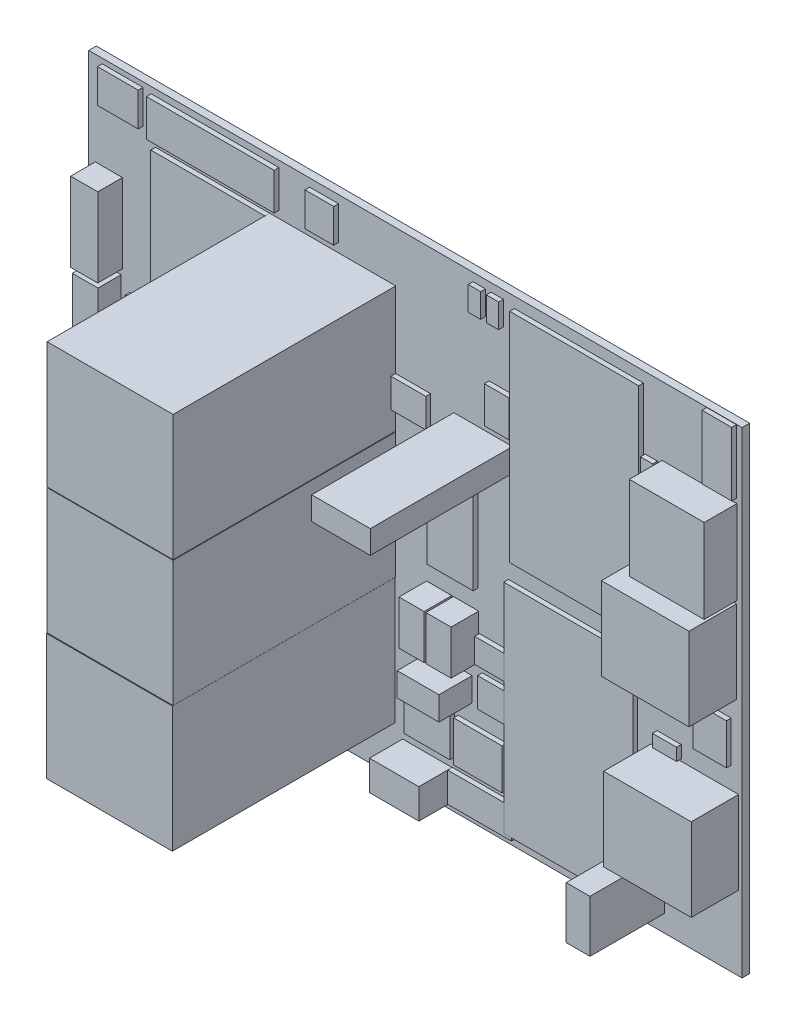
from build123d import *

# Parameters (mm, degrees)
ESQUISSE1_W                                    = 137.93375
ESQUISSE1_H                                    = 100.635
BOARD_DEPTH                                    = 1.6
ESQUISSE2_W                                    = 1.78
ESQUISSE2_H                                    = 3.14
CAP_0805_1_DEPTH                               = 1
ESQUISSE3_W                                    = 1.78
ESQUISSE3_H                                    = 3.14
CAP_0805_2_DEPTH                               = 1
ESQUISSE4_W                                    = 3.14
ESQUISSE4_H                                    = 1.78
CAP_0805_3_DEPTH                               = 1
ESQUISSE5_W                                    = 3.14
ESQUISSE5_H                                    = 1.78
CAP_0805_4_DEPTH                               = 1
ESQUISSE6_W                                    = 1.9914
ESQUISSE6_H                                    = 3.9968
EXTRUDE_C0805_1_DEPTH                          = 1
ESQUISSE7_W                                    = 1.9914
ESQUISSE7_H                                    = 3.9968
EXTRUDE_C0805_2_DEPTH                          = 1
ESQUISSE8_W                                    = 26.6
ESQUISSE8_H                                    = 26.55
SLPX102M200C4P3_47_000000_1_DEPTH              = 47
ESQUISSE9_W                                    = 26.6
ESQUISSE9_H                                    = 26.55
BOARD_OUTLINE2_DEPTH                           = 47
ESQUISSE10_W                                   = 26.6
ESQUISSE10_H                                   = 26.55
SLPX102M200C4P3_47_000000_3_DEPTH              = 47
ESQUISSE11_W                                   = 5.425
ESQUISSE11_H                                   = 10.85
TO254P490X1000X2143_3P_4_900000_1_DEPTH        = 4.9
ESQUISSE12_W                                   = 5.425
ESQUISSE12_H                                   = 10.85
TO254P490X1000X2143_3P_4_900000_2_DEPTH        = 4.9
ESQUISSE13_W                                   = 6.35
ESQUISSE13_H                                   = 3.625
SOP50P490X110_10N_1_100000_1_DEPTH             = 1.1
ESQUISSE14_W                                   = 7.6835
ESQUISSE14_H                                   = 5.1435
AVRISP_1_DEPTH                                 = 1
ESQUISSE15_W                                   = 18.5
ESQUISSE15_H                                   = 17.49
UJ2BH1TH_10_000000_1_DEPTH                     = 10
ESQUISSE16_W                                   = 18.5
ESQUISSE16_H                                   = 17.49
UJ2BH1TH_10_000000_2_DEPTH                     = 10
ESQUISSE17_W                                   = 7.1
ESQUISSE17_H                                   = 8.62
EXTRUDE_691210910003_1_DEPTH                   = 1
ESQUISSE18_W                                   = 10.425
ESQUISSE18_H                                   = 6.3
SHDR3W64P0X250_1X3_990X575X700_7_000000_DEPTH  = 7
ESQUISSE19_W                                   = 13.46
ESQUISSE19_H                                   = 6.25
JST_B4B_XH_A_LF_SN_1_DEPTH                     = 1
ESQUISSE20_W                                   = 6.25
ESQUISSE20_H                                   = 13.46
JST_B4B_XH_A_LF_SN_2_DEPTH                     = 1
ESQUISSE21_W                                   = 6.08
ESQUISSE21_H                                   = 7.1
EXTRUDE_691210910002_1_DEPTH                   = 1
ESQUISSE22_W                                   = 8.62
ESQUISSE22_H                                   = 7.1
EXTRUDE_691210910003_2_DEPTH                   = 1
ESQUISSE23_W                                   = 25.5016
ESQUISSE23_H                                   = 5.2832
JTAG_20_1_DEPTH                                = 1
ESQUISSE24_W                                   = 6.08
ESQUISSE24_H                                   = 7.1
EXTRUDE_691210910002_2_DEPTH                   = 1
ESQUISSE25_W                                   = 8.62
ESQUISSE25_H                                   = 7.1
EXTRUDE_691210910003_3_DEPTH                   = 1
ESQUISSE26_W                                   = 15.8
ESQUISSE26_H                                   = 17.74
SS52100001_6_900000_1_DEPTH                    = 6.9
ESQUISSE27_W                                   = 5.08
ESQUISSE27_H                                   = 2.6162
EXTRUDE_1X02_1_DEPTH                           = 1
ESQUISSE28_W                                   = 5.08
ESQUISSE28_H                                   = 2.6162
EXTRUDE_1X02_2_DEPTH                           = 1
ESQUISSE29_W                                   = 2.6162
ESQUISSE29_H                                   = 5.08
EXTRUDE_1X02_3_DEPTH                           = 1
ESQUISSE30_W                                   = 5.1562
ESQUISSE30_H                                   = 7.6962
EXTRUDE_2X03_1_DEPTH                           = 1
ESQUISSE31_W                                   = 2.6162
ESQUISSE31_H                                   = 5.08
EXTRUDE_1X02_4_DEPTH                           = 1
ESQUISSE32_W                                   = 2.6162
ESQUISSE32_H                                   = 5.08
EXTRUDE_1X02_5_DEPTH                           = 1
ESQUISSE33_W                                   = 2.6162
ESQUISSE33_H                                   = 5.08
EXTRUDE_1X02_6_DEPTH                           = 1
ESQUISSE34_W                                   = 27.215
ESQUISSE34_H                                   = 45.954
IRM_10_1_DEPTH                                 = 1
ESQUISSE35_W                                   = 27.215
ESQUISSE35_H                                   = 45.954
IRM_10_2_DEPTH                                 = 1
ESQUISSE36_W                                   = 5.325
ESQUISSE36_H                                   = 9.35
DIP762W58P254L450H584Q4N_5_840000_1_DEPTH      = 5.84
ESQUISSE37_W                                   = 5.325
ESQUISSE37_H                                   = 9.35
DIP762W58P254L450H584Q4N_5_840000_2_DEPTH      = 5.84
ESQUISSE38_W                                   = 5.735
ESQUISSE38_H                                   = 16.68
TO545P521X1594X2566_3P_5_210000_1_DEPTH        = 5.21
ESQUISSE39_W                                   = 7.005
ESQUISSE39_H                                   = 4.28
ZTX458_4_010000_1_DEPTH                        = 4.01
ESQUISSE40_W                                   = 7.005
ESQUISSE40_H                                   = 4.28
ZTX458_4_010000_2_DEPTH                        = 4.01
ESQUISSE41_W                                   = 5.355
ESQUISSE41_H                                   = 11.21
TO254P483X1028X1700_3P_4_830000_1_DEPTH        = 4.83
ESQUISSE42_W                                   = 1.966
ESQUISSE42_H                                   = 3.946
EXTRUDE_R0805_1_DEPTH                          = 1
ESQUISSE43_W                                   = 1.966
ESQUISSE43_H                                   = 3.946
EXTRUDE_R0805_2_DEPTH                          = 1
ESQUISSE44_W                                   = 1.966
ESQUISSE44_H                                   = 3.946
EXTRUDE_R0805_3_DEPTH                          = 1
ESQUISSE45_W                                   = 3.946
ESQUISSE45_H                                   = 1.966
EXTRUDE_R0805_4_DEPTH                          = 1
ESQUISSE46_W                                   = 1.966
ESQUISSE46_H                                   = 3.946
EXTRUDE_R0805_5_DEPTH                          = 1
ESQUISSE47_W                                   = 1.966
ESQUISSE47_H                                   = 3.946
EXTRUDE_R0805_6_DEPTH                          = 1
ESQUISSE48_W                                   = 1.966
ESQUISSE48_H                                   = 3.946
EXTRUDE_R0805_7_DEPTH                          = 1
ESQUISSE49_W                                   = 1.966
ESQUISSE49_H                                   = 3.946
EXTRUDE_R0805_8_DEPTH                          = 1
ESQUISSE50_W                                   = 3.946
ESQUISSE50_H                                   = 1.966
EXTRUDE_R0805_9_DEPTH                          = 1
ESQUISSE51_W                                   = 1.966
ESQUISSE51_H                                   = 3.946
EXTRUDE_R0805_10_DEPTH                         = 1
ESQUISSE52_W                                   = 1.966
ESQUISSE52_H                                   = 3.946
EXTRUDE_R0805_11_DEPTH                         = 1
ESQUISSE53_W                                   = 1.966
ESQUISSE53_H                                   = 3.946
EXTRUDE_R0805_12_DEPTH                         = 1
ESQUISSE54_W                                   = 1.966
ESQUISSE54_H                                   = 3.946
EXTRUDE_R0805_13_DEPTH                         = 1
ESQUISSE55_W                                   = 3.946
ESQUISSE55_H                                   = 1.966
EXTRUDE_R0805_14_DEPTH                         = 1
ESQUISSE56_W                                   = 1.966
ESQUISSE56_H                                   = 3.946
EXTRUDE_R0805_15_DEPTH                         = 1
ESQUISSE57_W                                   = 3.946
ESQUISSE57_H                                   = 1.966
EXTRUDE_R0805_16_DEPTH                         = 1
ESQUISSE58_W                                   = 1.966
ESQUISSE58_H                                   = 3.946
EXTRUDE_R0805_17_DEPTH                         = 1
ESQUISSE59_W                                   = 3.946
ESQUISSE59_H                                   = 1.966
EXTRUDE_R0805_18_DEPTH                         = 1
ESQUISSE60_W                                   = 1.966
ESQUISSE60_H                                   = 3.946
EXTRUDE_R0805_19_DEPTH                         = 1
ESQUISSE61_W                                   = 3.946
ESQUISSE61_H                                   = 1.966
EXTRUDE_R0805_20_DEPTH                         = 1
ESQUISSE62_W                                   = 3.946
ESQUISSE62_H                                   = 1.966
EXTRUDE_R0805_21_DEPTH                         = 1
ESQUISSE63_W                                   = 3.946
ESQUISSE63_H                                   = 1.966
EXTRUDE_R0805_22_DEPTH                         = 1
ESQUISSE64_W                                   = 1.966
ESQUISSE64_H                                   = 3.946
EXTRUDE_R0805_23_DEPTH                         = 1
ESQUISSE65_W                                   = 3.946
ESQUISSE65_H                                   = 1.966
EXTRUDE_R0805_24_DEPTH                         = 1
ESQUISSE66_W                                   = 1.966
ESQUISSE66_H                                   = 3.946
EXTRUDE_R0805_25_DEPTH                         = 1
ESQUISSE67_W                                   = 1.966
ESQUISSE67_H                                   = 3.946
EXTRUDE_R0805_26_DEPTH                         = 1
ESQUISSE68_W                                   = 1.966
ESQUISSE68_H                                   = 3.946
EXTRUDE_R0805_27_DEPTH                         = 1
ESQUISSE69_W                                   = 1.966
ESQUISSE69_H                                   = 3.946
EXTRUDE_R0805_28_DEPTH                         = 1
ESQUISSE70_W                                   = 1.966
ESQUISSE70_H                                   = 3.946
EXTRUDE_R0805_29_DEPTH                         = 1
ESQUISSE71_W                                   = 1.966
ESQUISSE71_H                                   = 3.946
EXTRUDE_R0805_30_DEPTH                         = 1
ESQUISSE72_W                                   = 1.966
ESQUISSE72_H                                   = 3.946
EXTRUDE_R0805_31_DEPTH                         = 1
ESQUISSE73_W                                   = 1.966
ESQUISSE73_H                                   = 3.946
EXTRUDE_R0805_32_DEPTH                         = 1
ESQUISSE74_W                                   = 1.9914
ESQUISSE74_H                                   = 3.9968
EXTRUDE_M0805_1_DEPTH                          = 1
ESQUISSE75_W                                   = 1.9914
ESQUISSE75_H                                   = 3.9968
EXTRUDE_M0805_2_DEPTH                          = 1
ESQUISSE76_W                                   = 1.9914
ESQUISSE76_H                                   = 3.9968
EXTRUDE_M0805_3_DEPTH                          = 1
ESQUISSE77_W                                   = 1.9914
ESQUISSE77_H                                   = 3.9968
EXTRUDE_M0805_4_DEPTH                          = 1
ESQUISSE78_W                                   = 1.9914
ESQUISSE78_H                                   = 3.9968
EXTRUDE_M0805_5_DEPTH                          = 1
ESQUISSE79_W                                   = 1.9914
ESQUISSE79_H                                   = 3.9968
EXTRUDE_M0805_6_DEPTH                          = 1
ESQUISSE80_W                                   = 1.9914
ESQUISSE80_H                                   = 3.9968
EXTRUDE_M0805_7_DEPTH                          = 1
ESQUISSE81_W                                   = 1.9914
ESQUISSE81_H                                   = 3.9968
EXTRUDE_M0805_8_DEPTH                          = 1
ESQUISSE82_W                                   = 1.9914
ESQUISSE82_H                                   = 3.9968
EXTRUDE_M0805_9_DEPTH                          = 1
ESQUISSE83_W                                   = 1.9914
ESQUISSE83_H                                   = 3.9968
EXTRUDE_M0805_10_DEPTH                         = 1
ESQUISSE84_W                                   = 1.9914
ESQUISSE84_H                                   = 3.9968
EXTRUDE_M0805_11_DEPTH                         = 1
ESQUISSE85_W                                   = 1.9914
ESQUISSE85_H                                   = 3.9968
EXTRUDE_M0805_12_DEPTH                         = 1
ESQUISSE86_W                                   = 26.975
ESQUISSE86_H                                   = 7.8262
RS05_69_70_1_DEPTH                             = 1
ESQUISSE87_W                                   = 26.975
ESQUISSE87_H                                   = 7.8262
RS05_69_70_2_DEPTH                             = 1
ESQUISSE88_W                                   = 2.032
ESQUISSE88_H                                   = 7.874
EXTRUDE_0204_7_1_DEPTH                         = 1
ESQUISSE89_W                                   = 2.032
ESQUISSE89_H                                   = 7.874
EXTRUDE_0204_7_2_DEPTH                         = 1
ESQUISSE90_W                                   = 2.032
ESQUISSE90_H                                   = 7.874
EXTRUDE_0204_7_3_DEPTH                         = 1
ESQUISSE91_W                                   = 7.874
ESQUISSE91_H                                   = 2.032
EXTRUDE_0204_7_4_DEPTH                         = 1
ESQUISSE92_W                                   = 2.032
ESQUISSE92_H                                   = 7.874
EXTRUDE_0204_7_5_DEPTH                         = 1
ESQUISSE93_W                                   = 7.874
ESQUISSE93_H                                   = 2.032
EXTRUDE_0204_7_6_DEPTH                         = 1
ESQUISSE94_W                                   = 7.622509
ESQUISSE94_H                                   = 6.139509
EXTRUDE_1825910_6_1_DEPTH                      = 1
ESQUISSE95_W                                   = 7.622509
ESQUISSE95_H                                   = 6.139509
EXTRUDE_1825910_6_2_DEPTH                      = 1
ESQUISSE96_W                                   = 7.8592
ESQUISSE96_H                                   = 10.6354
SSOP28DB_1_DEPTH                               = 1
ESQUISSE97_W                                   = 5.02
ESQUISSE97_H                                   = 10.975
ON_SEMI_LM317BTG_0_15_750000_1_DEPTH           = 15.75
ESQUISSE98_W                                   = 9.6
ESQUISSE98_H                                   = 7.7
NATIONAL_SEMICONDUCTOR_LM1117IMPX_3_3_NO_DEPTH = 1
ESQUISSE99_W                                   = 9.6
ESQUISSE99_H                                   = 7.7
NATIONAL_SEMICONDUCTOR_LM1117IMPX_3_2_DEPTH    = 1
ESQUISSE100_W                                  = 11
ESQUISSE100_H                                  = 11
QFP80P900X900X120_32N_1_DEPTH                  = 1
ESQUISSE101_W                                  = 9.7
ESQUISSE101_H                                  = 10.71
TEXAS_INSTRUMENTS_TLC2262CP_0_1_DEPTH          = 1
ESQUISSE102_W                                  = 10.2362
ESQUISSE102_H                                  = 8.5852
DIP254P762X533_8_1_DEPTH                       = 1
ESQUISSE103_W                                  = 9.7
ESQUISSE103_H                                  = 20.2
TEXAS_INSTRUMENTS_TLC2264CN_0_1_DEPTH          = 1
ESQUISSE104_W                                  = 24.1
ESQUISSE104_H                                  = 34.2
SC_10_30J_1_DEPTH                              = 1
ESQUISSE105_W                                  = 24.1
ESQUISSE105_H                                  = 34.2
SC_10_30J_2_DEPTH                              = 1
ESQUISSE106_W                                  = 10.42
ESQUISSE106_H                                  = 11.46
QFP50P900X900X160_48N_1_DEPTH                  = 1
ESQUISSE107_W                                  = 12.376
ESQUISSE107_H                                  = 4.902
FOX_ELECTRONICS_FOXSLF_080_20_0_30_02000_DEPTH = 30.02
ESQUISSE108_W                                  = 8.826
ESQUISSE108_H                                  = 5
CSTLS16M0X53ZA0_7_000000_1_DEPTH               = 7


with BuildPart() as part:
    # Esquisse1 → BOARD (new body)
    with BuildSketch(Plane.XY):
        with Locations((66.903125, 50.15875)):
            Rectangle(ESQUISSE1_W, ESQUISSE1_H)
    extrude(amount=BOARD_DEPTH)


with BuildPart() as body_2:
    # Esquisse2 → CAP_0805-1 (new body)
    with BuildSketch(Plane.XY):
        with Locations((110.01375, 27.78125)):
            Rectangle(ESQUISSE2_W, ESQUISSE2_H)
    extrude(amount=-CAP_0805_1_DEPTH)


with BuildPart() as body_3:
    # Esquisse3 → CAP_0805-2 (new body)
    with BuildSketch(Plane.XY):
        with Locations((110.01375, 24.4475)):
            Rectangle(ESQUISSE3_W, ESQUISSE3_H)
    extrude(amount=-CAP_0805_2_DEPTH)


with BuildPart() as body_4:
    # Esquisse4 → CAP_0805-3 (new body)
    with BuildSketch(Plane.XY):
        with Locations((95.72625, 24.92375)):
            Rectangle(ESQUISSE4_W, ESQUISSE4_H)
    extrude(amount=-CAP_0805_3_DEPTH)


with BuildPart() as body_5:
    # Esquisse5 → CAP_0805-4 (new body)
    with BuildSketch(Plane.XY):
        with Locations((96.36125, 38.735)):
            Rectangle(ESQUISSE5_W, ESQUISSE5_H)
    extrude(amount=-CAP_0805_4_DEPTH)


with BuildPart() as body_6:
    # Esquisse6 → C0805-1 (new body)
    with BuildSketch(Plane.XY):
        with Locations((69.04355, 17.78)):
            Rectangle(ESQUISSE6_W, ESQUISSE6_H)
    extrude(amount=-EXTRUDE_C0805_1_DEPTH)


with BuildPart() as body_7:
    # Esquisse7 → C0805-2 (new body)
    with BuildSketch(Plane.XY):
        with Locations((69.04355, 12.3825)):
            Rectangle(ESQUISSE7_W, ESQUISSE7_H)
    extrude(amount=-EXTRUDE_C0805_2_DEPTH)


with BuildPart() as body_8:
    # Esquisse8 → SLPX102M200C4P3_47.000000-1 (new body)
    with BuildSketch(Plane.XY.offset(1.6)):
        with Locations((49.45, 49.8725)):
            Rectangle(ESQUISSE8_W, ESQUISSE8_H)
    extrude(amount=SLPX102M200C4P3_47_000000_1_DEPTH)


with BuildPart() as body_9:
    # Esquisse9 → Board_Outline2 (new body)
    with BuildSketch(Plane.XY.offset(1.6)):
        with Locations((49.45, 76.5425)):
            Rectangle(ESQUISSE9_W, ESQUISSE9_H)
    extrude(amount=BOARD_OUTLINE2_DEPTH)


with BuildPart() as body_10:
    # Esquisse10 → SLPX102M200C4P3_47.000000-3 (new body)
    with BuildSketch(Plane.XY.offset(1.6)):
        with Locations((49.2925, 23.1525)):
            Rectangle(ESQUISSE10_W, ESQUISSE10_H)
    extrude(amount=SLPX102M200C4P3_47_000000_3_DEPTH)


with BuildPart() as body_11:
    # Esquisse11 → TO254P490X1000X2143-3P_4.900000-1 (new body)
    with BuildSketch(Plane.XY.offset(1.6)):
        with Locations((2.075, 57.4675)):
            Rectangle(ESQUISSE11_W, ESQUISSE11_H)
    extrude(amount=TO254P490X1000X2143_3P_4_900000_1_DEPTH)


with BuildPart() as body_12:
    # Esquisse12 → TO254P490X1000X2143-3P_4.900000-2 (new body)
    with BuildSketch(Plane.XY.offset(1.6)):
        with Locations((1.7575, 28.575)):
            Rectangle(ESQUISSE12_W, ESQUISSE12_H)
    extrude(amount=TO254P490X1000X2143_3P_4_900000_2_DEPTH)


with BuildPart() as body_13:
    # Esquisse13 → SOP50P490X110-10N_1.100000-1 (new body)
    with BuildSketch(Plane.XY):
        with Locations((82.70875, 13.64)):
            Rectangle(ESQUISSE13_W, ESQUISSE13_H)
    extrude(amount=-SOP50P490X110_10N_1_100000_1_DEPTH)


with BuildPart() as body_14:
    # Esquisse14 → AVRISP-1 (new body)
    with BuildSketch(Plane.XY.offset(1.6)):
        with Locations((84.2645, 32.512)):
            Rectangle(ESQUISSE14_W, ESQUISSE14_H)
    extrude(amount=AVRISP_1_DEPTH)


with BuildPart() as body_15:
    # Esquisse15 → UJ2BH1TH_10.000000-1 (new body)
    with BuildSketch(Plane.XY.offset(1.6)):
        with Locations((125.89375, 24.28875)):
            Rectangle(ESQUISSE15_W, ESQUISSE15_H)
    extrude(amount=UJ2BH1TH_10_000000_1_DEPTH)


with BuildPart() as body_16:
    # Esquisse16 → UJ2BH1TH_10.000000-2 (new body)
    with BuildSketch(Plane.XY.offset(1.6)):
        with Locations((125.4175, 58.89625)):
            Rectangle(ESQUISSE16_W, ESQUISSE16_H)
    extrude(amount=UJ2BH1TH_10_000000_2_DEPTH)


with BuildPart() as body_17:
    # Esquisse17 → 691210910003-1 (new body)
    with BuildSketch(Plane.XY.offset(1.6)):
        with Locations((130.01625, 41.91)):
            Rectangle(ESQUISSE17_W, ESQUISSE17_H)
    extrude(amount=EXTRUDE_691210910003_1_DEPTH)


with BuildPart() as body_18:
    # Esquisse18 → SHDR3W64P0X250_1X3_990X575X700_7.000000-1 (new body)
    with BuildSketch(Plane.XY.offset(1.6)):
        with Locations((69.42625, 4.555)):
            Rectangle(ESQUISSE18_W, ESQUISSE18_H)
    extrude(amount=SHDR3W64P0X250_1X3_990X575X700_7_000000_DEPTH)


with BuildPart() as body_19:
    # Esquisse19 → JST_B4B-XH-A_LF__SN_-1 (new body)
    with BuildSketch(Plane.XY.offset(1.6)):
        with Locations((81.46125, 4.6525)):
            Rectangle(ESQUISSE19_W, ESQUISSE19_H)
    extrude(amount=JST_B4B_XH_A_LF_SN_1_DEPTH)


with BuildPart() as body_20:
    # Esquisse20 → JST_B4B-XH-A_LF__SN_-2 (new body)
    with BuildSketch(Plane.XY.offset(1.6)):
        with Locations((131.555, 93.685)):
            Rectangle(ESQUISSE20_W, ESQUISSE20_H)
    extrude(amount=JST_B4B_XH_A_LF_SN_2_DEPTH)


with BuildPart() as body_21:
    # Esquisse21 → 691210910002-1 (new body)
    with BuildSketch(Plane.XY.offset(1.6)):
        with Locations((47.625, 95.25)):
            Rectangle(ESQUISSE21_W, ESQUISSE21_H)
    extrude(amount=EXTRUDE_691210910002_1_DEPTH)


with BuildPart() as body_22:
    # Esquisse22 → 691210910003-2 (new body)
    with BuildSketch(Plane.XY.offset(1.6)):
        with Locations((5.08, 95.885)):
            Rectangle(ESQUISSE22_W, ESQUISSE22_H)
    extrude(amount=EXTRUDE_691210910003_2_DEPTH)


with BuildPart() as body_23:
    # Esquisse23 → JTAG-20-1 (new body)
    with BuildSketch(Plane.XY):
        with Locations((65.3542, 96.2025)):
            Rectangle(ESQUISSE23_W, ESQUISSE23_H)
    extrude(amount=-JTAG_20_1_DEPTH)


with BuildPart() as body_24:
    # Esquisse24 → 691210910002-2 (new body)
    with BuildSketch(Plane.XY.offset(1.6)):
        with Locations((46.99, 4.7625)):
            Rectangle(ESQUISSE24_W, ESQUISSE24_H)
    extrude(amount=EXTRUDE_691210910002_2_DEPTH)


with BuildPart() as body_25:
    # Esquisse25 → 691210910003-3 (new body)
    with BuildSketch(Plane.XY.offset(1.6)):
        with Locations((5.715, 4.445)):
            Rectangle(ESQUISSE25_W, ESQUISSE25_H)
    extrude(amount=EXTRUDE_691210910003_3_DEPTH)


with BuildPart() as body_26:
    # Esquisse26 → SS52100001_6.900000-1 (new body)
    with BuildSketch(Plane.XY.offset(1.6)):
        with Locations((126.875, 77.16)):
            Rectangle(ESQUISSE26_W, ESQUISSE26_H)
    extrude(amount=SS52100001_6_900000_1_DEPTH)


with BuildPart() as body_27:
    # Esquisse27 → 1X02-1 (new body)
    with BuildSketch(Plane.XY.offset(1.6)):
        with Locations((120.49125, 34.80435)):
            Rectangle(ESQUISSE27_W, ESQUISSE27_H)
    extrude(amount=EXTRUDE_1X02_1_DEPTH)


with BuildPart() as body_28:
    # Esquisse28 → 1X02-2 (new body)
    with BuildSketch(Plane.XY.offset(1.6)):
        with Locations((121.44375, 48.13935)):
            Rectangle(ESQUISSE28_W, ESQUISSE28_H)
    extrude(amount=EXTRUDE_1X02_2_DEPTH)


with BuildPart() as body_29:
    # Esquisse29 → 1X02-3 (new body)
    with BuildSketch(Plane.XY.offset(1.6)):
        with Locations((116.8781, 71.27875)):
            Rectangle(ESQUISSE29_W, ESQUISSE29_H)
    extrude(amount=EXTRUDE_1X02_3_DEPTH)


with BuildPart() as body_30:
    # Esquisse30 → 2X03-1 (new body)
    with BuildSketch(Plane.XY.offset(1.6)):
        with Locations((85.0519, 78.4606)):
            Rectangle(ESQUISSE30_W, ESQUISSE30_H)
    extrude(amount=EXTRUDE_2X03_1_DEPTH)


with BuildPart() as body_31:
    # Esquisse31 → 1X02-4 (new body)
    with BuildSketch(Plane.XY.offset(1.6)):
        with Locations((84.1756, 96.2025)):
            Rectangle(ESQUISSE31_W, ESQUISSE31_H)
    extrude(amount=EXTRUDE_1X02_4_DEPTH)


with BuildPart() as body_32:
    # Esquisse32 → 1X02-5 (new body)
    with BuildSketch(Plane.XY.offset(1.6)):
        with Locations((80.3656, 96.2025)):
            Rectangle(ESQUISSE32_W, ESQUISSE32_H)
    extrude(amount=EXTRUDE_1X02_5_DEPTH)


with BuildPart() as body_33:
    # Esquisse33 → 1X02-6 (new body)
    with BuildSketch(Plane.XY.offset(1.6)):
        with Locations((116.71935, 82.8675)):
            Rectangle(ESQUISSE33_W, ESQUISSE33_H)
    extrude(amount=EXTRUDE_1X02_6_DEPTH)


with BuildPart() as body_34:
    # Esquisse34 → IRM-10-1 (new body)
    with BuildSketch(Plane.XY.offset(1.6)):
        with Locations((100.1845, 25.0925)):
            Rectangle(ESQUISSE34_W, ESQUISSE34_H)
    extrude(amount=IRM_10_1_DEPTH)


with BuildPart() as body_35:
    # Esquisse35 → IRM-10-2 (new body)
    with BuildSketch(Plane.XY.offset(1.6)):
        with Locations((101.428, 75.2375)):
            Rectangle(ESQUISSE35_W, ESQUISSE35_H)
    extrude(amount=IRM_10_2_DEPTH)


with BuildPart() as body_36:
    # Esquisse36 → DIP762W58P254L450H584Q4N_5.840000-1 (new body)
    with BuildSketch(Plane.XY.offset(1.6)):
        with Locations((77.61625, 34.44875)):
            Rectangle(ESQUISSE36_W, ESQUISSE36_H)
    extrude(amount=DIP762W58P254L450H584Q4N_5_840000_1_DEPTH)


with BuildPart() as body_37:
    # Esquisse37 → DIP762W58P254L450H584Q4N_5.840000-2 (new body)
    with BuildSketch(Plane.XY.offset(1.6)):
        with Locations((71.92625, 34.44875)):
            Rectangle(ESQUISSE37_W, ESQUISSE37_H)
    extrude(amount=DIP762W58P254L450H584Q4N_5_840000_2_DEPTH)


with BuildPart() as body_38:
    # Esquisse38 → TO545P521X1594X2566-3P_5.210000-1 (new body)
    with BuildSketch(Plane.XY.offset(1.6)):
        with Locations((2.1925, 72.4425)):
            Rectangle(ESQUISSE38_W, ESQUISSE38_H)
    extrude(amount=TO545P521X1594X2566_3P_5_210000_1_DEPTH)


with BuildPart() as body_39:
    # Esquisse39 → ZTX458_4.010000-1 (new body)
    with BuildSketch(Plane.XY.offset(1.6)):
        with Locations((17.88, 53.0225)):
            Rectangle(ESQUISSE39_W, ESQUISSE39_H)
    extrude(amount=ZTX458_4_010000_1_DEPTH)


with BuildPart() as body_40:
    # Esquisse40 → ZTX458_4.010000-2 (new body)
    with BuildSketch(Plane.XY.offset(1.6)):
        with Locations((17.88, 46.99)):
            Rectangle(ESQUISSE40_W, ESQUISSE40_H)
    extrude(amount=ZTX458_4_010000_2_DEPTH)


with BuildPart() as body_41:
    # Esquisse41 → TO254P483X1028X1700-3P_4.830000-1 (new body)
    with BuildSketch(Plane.XY.offset(1.6)):
        with Locations((1.8725, 15.875)):
            Rectangle(ESQUISSE41_W, ESQUISSE41_H)
    extrude(amount=TO254P483X1028X1700_3P_4_830000_1_DEPTH)


with BuildPart() as body_42:
    # Esquisse42 → R0805-1 (new body)
    with BuildSketch(Plane.XY):
        with Locations((110.01375, 16.51)):
            Rectangle(ESQUISSE42_W, ESQUISSE42_H)
    extrude(amount=-EXTRUDE_R0805_1_DEPTH)


with BuildPart() as body_43:
    # Esquisse43 → R0805-2 (new body)
    with BuildSketch(Plane.XY):
        with Locations((110.01375, 12.22375)):
            Rectangle(ESQUISSE43_W, ESQUISSE43_H)
    extrude(amount=-EXTRUDE_R0805_2_DEPTH)


with BuildPart() as body_44:
    # Esquisse44 → R0805-3 (new body)
    with BuildSketch(Plane.XY):
        with Locations((119.53875, 10.31875)):
            Rectangle(ESQUISSE44_W, ESQUISSE44_H)
    extrude(amount=-EXTRUDE_R0805_3_DEPTH)


with BuildPart() as body_45:
    # Esquisse45 → R0805-4 (new body)
    with BuildSketch(Plane.XY):
        with Locations((70.64375, 7.3025)):
            Rectangle(ESQUISSE45_W, ESQUISSE45_H)
    extrude(amount=-EXTRUDE_R0805_4_DEPTH)


with BuildPart() as body_46:
    # Esquisse46 → R0805-5 (new body)
    with BuildSketch(Plane.XY):
        with Locations((121.76125, 10.31875)):
            Rectangle(ESQUISSE46_W, ESQUISSE46_H)
    extrude(amount=-EXTRUDE_R0805_5_DEPTH)


with BuildPart() as body_47:
    # Esquisse47 → R0805-6 (new body)
    with BuildSketch(Plane.XY):
        with Locations((121.76125, 6.19125)):
            Rectangle(ESQUISSE47_W, ESQUISSE47_H)
    extrude(amount=-EXTRUDE_R0805_6_DEPTH)


with BuildPart() as body_48:
    # Esquisse48 → R0805-7 (new body)
    with BuildSketch(Plane.XY):
        with Locations((107.47375, 25.87625)):
            Rectangle(ESQUISSE48_W, ESQUISSE48_H)
    extrude(amount=-EXTRUDE_R0805_7_DEPTH)


with BuildPart() as body_49:
    # Esquisse49 → R0805-8 (new body)
    with BuildSketch(Plane.XY):
        with Locations((105.25125, 25.87625)):
            Rectangle(ESQUISSE49_W, ESQUISSE49_H)
    extrude(amount=-EXTRUDE_R0805_8_DEPTH)


with BuildPart() as body_50:
    # Esquisse50 → R0805-9 (new body)
    with BuildSketch(Plane.XY):
        with Locations((84.455, 22.86)):
            Rectangle(ESQUISSE50_W, ESQUISSE50_H)
    extrude(amount=-EXTRUDE_R0805_9_DEPTH)


with BuildPart() as body_51:
    # Esquisse51 → R0805-10 (new body)
    with BuildSketch(Plane.XY):
        with Locations((77.31125, 13.6525)):
            Rectangle(ESQUISSE51_W, ESQUISSE51_H)
    extrude(amount=-EXTRUDE_R0805_10_DEPTH)


with BuildPart() as body_52:
    # Esquisse52 → R0805-11 (new body)
    with BuildSketch(Plane.XY):
        with Locations((71.755, 17.78)):
            Rectangle(ESQUISSE52_W, ESQUISSE52_H)
    extrude(amount=-EXTRUDE_R0805_11_DEPTH)


with BuildPart() as body_53:
    # Esquisse53 → R0805-12 (new body)
    with BuildSketch(Plane.XY):
        with Locations((71.59625, 12.3825)):
            Rectangle(ESQUISSE53_W, ESQUISSE53_H)
    extrude(amount=-EXTRUDE_R0805_12_DEPTH)


with BuildPart() as body_54:
    # Esquisse54 → R0805-13 (new body)
    with BuildSketch(Plane.XY):
        with Locations((73.3425, 46.99)):
            Rectangle(ESQUISSE54_W, ESQUISSE54_H)
    extrude(amount=-EXTRUDE_R0805_13_DEPTH)


with BuildPart() as body_55:
    # Esquisse55 → R0805-14 (new body)
    with BuildSketch(Plane.XY):
        with Locations((77.31125, 28.41625)):
            Rectangle(ESQUISSE55_W, ESQUISSE55_H)
    extrude(amount=-EXTRUDE_R0805_14_DEPTH)


with BuildPart() as body_56:
    # Esquisse56 → R0805-15 (new body)
    with BuildSketch(Plane.XY):
        with Locations((69.215, 46.99)):
            Rectangle(ESQUISSE56_W, ESQUISSE56_H)
    extrude(amount=-EXTRUDE_R0805_15_DEPTH)


with BuildPart() as body_57:
    # Esquisse57 → R0805-16 (new body)
    with BuildSketch(Plane.XY):
        with Locations((119.22125, 55.245)):
            Rectangle(ESQUISSE57_W, ESQUISSE57_H)
    extrude(amount=-EXTRUDE_R0805_16_DEPTH)


with BuildPart() as body_58:
    # Esquisse58 → R0805-17 (new body)
    with BuildSketch(Plane.XY):
        with Locations((73.3425, 51.7525)):
            Rectangle(ESQUISSE58_W, ESQUISSE58_H)
    extrude(amount=-EXTRUDE_R0805_17_DEPTH)


with BuildPart() as body_59:
    # Esquisse59 → R0805-18 (new body)
    with BuildSketch(Plane.XY):
        with Locations((77.94625, 40.3225)):
            Rectangle(ESQUISSE59_W, ESQUISSE59_H)
    extrude(amount=-EXTRUDE_R0805_18_DEPTH)


with BuildPart() as body_60:
    # Esquisse60 → R0805-19 (new body)
    with BuildSketch(Plane.XY):
        with Locations((69.215, 51.7525)):
            Rectangle(ESQUISSE60_W, ESQUISSE60_H)
    extrude(amount=-EXTRUDE_R0805_19_DEPTH)


with BuildPart() as body_61:
    # Esquisse61 → R0805-20 (new body)
    with BuildSketch(Plane.XY):
        with Locations((119.22125, 59.69)):
            Rectangle(ESQUISSE61_W, ESQUISSE61_H)
    extrude(amount=-EXTRUDE_R0805_20_DEPTH)


with BuildPart() as body_62:
    # Esquisse62 → R0805-21 (new body)
    with BuildSketch(Plane.XY):
        with Locations((72.23125, 40.48125)):
            Rectangle(ESQUISSE62_W, ESQUISSE62_H)
    extrude(amount=-EXTRUDE_R0805_21_DEPTH)


with BuildPart() as body_63:
    # Esquisse63 → R0805-22 (new body)
    with BuildSketch(Plane.XY):
        with Locations((119.22125, 57.4675)):
            Rectangle(ESQUISSE63_W, ESQUISSE63_H)
    extrude(amount=-EXTRUDE_R0805_22_DEPTH)


with BuildPart() as body_64:
    # Esquisse64 → R0805-23 (new body)
    with BuildSketch(Plane.XY):
        with Locations((73.3425, 59.3725)):
            Rectangle(ESQUISSE64_W, ESQUISSE64_H)
    extrude(amount=-EXTRUDE_R0805_23_DEPTH)


with BuildPart() as body_65:
    # Esquisse65 → R0805-24 (new body)
    with BuildSketch(Plane.XY):
        with Locations((71.59625, 28.41625)):
            Rectangle(ESQUISSE65_W, ESQUISSE65_H)
    extrude(amount=-EXTRUDE_R0805_24_DEPTH)


with BuildPart() as body_66:
    # Esquisse66 → R0805-25 (new body)
    with BuildSketch(Plane.XY):
        with Locations((69.215, 59.3725)):
            Rectangle(ESQUISSE66_W, ESQUISSE66_H)
    extrude(amount=-EXTRUDE_R0805_25_DEPTH)


with BuildPart() as body_67:
    # Esquisse67 → R0805-26 (new body)
    with BuildSketch(Plane.XY):
        with Locations((77.1525, 59.3725)):
            Rectangle(ESQUISSE67_W, ESQUISSE67_H)
    extrude(amount=-EXTRUDE_R0805_26_DEPTH)


with BuildPart() as body_68:
    # Esquisse68 → R0805-27 (new body)
    with BuildSketch(Plane.XY):
        with Locations((81.28, 59.3725)):
            Rectangle(ESQUISSE68_W, ESQUISSE68_H)
    extrude(amount=-EXTRUDE_R0805_27_DEPTH)


with BuildPart() as body_69:
    # Esquisse69 → R0805-28 (new body)
    with BuildSketch(Plane.XY):
        with Locations((69.85, 65.56375)):
            Rectangle(ESQUISSE69_W, ESQUISSE69_H)
    extrude(amount=-EXTRUDE_R0805_28_DEPTH)


with BuildPart() as body_70:
    # Esquisse70 → R0805-29 (new body)
    with BuildSketch(Plane.XY):
        with Locations((77.1525, 46.99)):
            Rectangle(ESQUISSE70_W, ESQUISSE70_H)
    extrude(amount=-EXTRUDE_R0805_29_DEPTH)


with BuildPart() as body_71:
    # Esquisse71 → R0805-30 (new body)
    with BuildSketch(Plane.XY):
        with Locations((81.28, 46.99)):
            Rectangle(ESQUISSE71_W, ESQUISSE71_H)
    extrude(amount=-EXTRUDE_R0805_30_DEPTH)


with BuildPart() as body_72:
    # Esquisse72 → R0805-31 (new body)
    with BuildSketch(Plane.XY):
        with Locations((81.28, 51.7525)):
            Rectangle(ESQUISSE72_W, ESQUISSE72_H)
    extrude(amount=-EXTRUDE_R0805_31_DEPTH)


with BuildPart() as body_73:
    # Esquisse73 → R0805-32 (new body)
    with BuildSketch(Plane.XY):
        with Locations((77.1525, 51.7525)):
            Rectangle(ESQUISSE73_W, ESQUISSE73_H)
    extrude(amount=-EXTRUDE_R0805_32_DEPTH)


with BuildPart() as body_74:
    # Esquisse74 → M0805-1 (new body)
    with BuildSketch(Plane.XY):
        with Locations((67.6402, 89.2175)):
            Rectangle(ESQUISSE74_W, ESQUISSE74_H)
    extrude(amount=-EXTRUDE_M0805_1_DEPTH)


with BuildPart() as body_75:
    # Esquisse75 → M0805-2 (new body)
    with BuildSketch(Plane.XY):
        with Locations((69.8627, 89.2175)):
            Rectangle(ESQUISSE75_W, ESQUISSE75_H)
    extrude(amount=-EXTRUDE_M0805_2_DEPTH)


with BuildPart() as body_76:
    # Esquisse76 → M0805-3 (new body)
    with BuildSketch(Plane.XY):
        with Locations((72.0852, 89.2175)):
            Rectangle(ESQUISSE76_W, ESQUISSE76_H)
    extrude(amount=-EXTRUDE_M0805_3_DEPTH)


with BuildPart() as body_77:
    # Esquisse77 → M0805-4 (new body)
    with BuildSketch(Plane.XY):
        with Locations((81.5848, 89.2175)):
            Rectangle(ESQUISSE77_W, ESQUISSE77_H)
    extrude(amount=-EXTRUDE_M0805_4_DEPTH)


with BuildPart() as body_78:
    # Esquisse78 → M0805-5 (new body)
    with BuildSketch(Plane.XY):
        with Locations((83.8073, 89.2175)):
            Rectangle(ESQUISSE78_W, ESQUISSE78_H)
    extrude(amount=-EXTRUDE_M0805_5_DEPTH)


with BuildPart() as body_79:
    # Esquisse79 → M0805-6 (new body)
    with BuildSketch(Plane.XY):
        with Locations((79.3623, 89.2175)):
            Rectangle(ESQUISSE79_W, ESQUISSE79_H)
    extrude(amount=-EXTRUDE_M0805_6_DEPTH)


with BuildPart() as body_80:
    # Esquisse80 → M0805-7 (new body)
    with BuildSketch(Plane.XY):
        with Locations((74.44105, 89.2175)):
            Rectangle(ESQUISSE80_W, ESQUISSE80_H)
    extrude(amount=-EXTRUDE_M0805_7_DEPTH)


with BuildPart() as body_81:
    # Esquisse81 → M0805-8 (new body)
    with BuildSketch(Plane.XY):
        with Locations((76.8477, 89.2175)):
            Rectangle(ESQUISSE81_W, ESQUISSE81_H)
    extrude(amount=-EXTRUDE_M0805_8_DEPTH)


with BuildPart() as body_82:
    # Esquisse82 → M0805-9 (new body)
    with BuildSketch(Plane.XY):
        with Locations((76.1873, 65.56375)):
            Rectangle(ESQUISSE82_W, ESQUISSE82_H)
    extrude(amount=-EXTRUDE_M0805_9_DEPTH)


with BuildPart() as body_83:
    # Esquisse83 → M0805-10 (new body)
    with BuildSketch(Plane.XY):
        with Locations((78.25105, 65.56375)):
            Rectangle(ESQUISSE83_W, ESQUISSE83_H)
    extrude(amount=-EXTRUDE_M0805_10_DEPTH)


with BuildPart() as body_84:
    # Esquisse84 → M0805-11 (new body)
    with BuildSketch(Plane.XY):
        with Locations((72.0598, 65.56375)):
            Rectangle(ESQUISSE84_W, ESQUISSE84_H)
    extrude(amount=-EXTRUDE_M0805_11_DEPTH)


with BuildPart() as body_85:
    # Esquisse85 → M0805-12 (new body)
    with BuildSketch(Plane.XY):
        with Locations((74.12355, 65.56375)):
            Rectangle(ESQUISSE85_W, ESQUISSE85_H)
    extrude(amount=-EXTRUDE_M0805_12_DEPTH)


with BuildPart() as body_86:
    # Esquisse86 → RS05_69-70-1 (new body)
    with BuildSketch(Plane.XY.offset(1.6)):
        with Locations((24.6, 95.2119)):
            Rectangle(ESQUISSE86_W, ESQUISSE86_H)
    extrude(amount=RS05_69_70_1_DEPTH)


with BuildPart() as body_87:
    # Esquisse87 → RS05_69-70-2 (new body)
    with BuildSketch(Plane.XY.offset(1.6)):
        with Locations((25.235, 4.7244)):
            Rectangle(ESQUISSE87_W, ESQUISSE87_H)
    extrude(amount=RS05_69_70_2_DEPTH)


with BuildPart() as body_88:
    # Esquisse88 → 0204_7-1 (new body)
    with BuildSketch(Plane.XY):
        with Locations((7.62, 72.1995)):
            Rectangle(ESQUISSE88_W, ESQUISSE88_H)
    extrude(amount=-EXTRUDE_0204_7_1_DEPTH)


with BuildPart() as body_89:
    # Esquisse89 → 0204_7-2 (new body)
    with BuildSketch(Plane.XY.offset(1.6)):
        with Locations((7.62, 56.642)):
            Rectangle(ESQUISSE89_W, ESQUISSE89_H)
    extrude(amount=EXTRUDE_0204_7_2_DEPTH)


with BuildPart() as body_90:
    # Esquisse90 → 0204_7-3 (new body)
    with BuildSketch(Plane.XY.offset(1.6)):
        with Locations((7.62, 15.4305)):
            Rectangle(ESQUISSE90_W, ESQUISSE90_H)
    extrude(amount=EXTRUDE_0204_7_3_DEPTH)


with BuildPart() as body_91:
    # Esquisse91 → 0204_7-4 (new body)
    with BuildSketch(Plane.XY.offset(1.6)):
        with Locations((29.337, 49.8475)):
            Rectangle(ESQUISSE91_W, ESQUISSE91_H)
    extrude(amount=EXTRUDE_0204_7_4_DEPTH)


with BuildPart() as body_92:
    # Esquisse92 → 0204_7-5 (new body)
    with BuildSketch(Plane.XY.offset(1.6)):
        with Locations((7.62, 36.703)):
            Rectangle(ESQUISSE92_W, ESQUISSE92_H)
    extrude(amount=EXTRUDE_0204_7_5_DEPTH)


with BuildPart() as body_93:
    # Esquisse93 → 0204_7-6 (new body)
    with BuildSketch(Plane.XY.offset(1.6)):
        with Locations((29.337, 52.3875)):
            Rectangle(ESQUISSE93_W, ESQUISSE93_H)
    extrude(amount=EXTRUDE_0204_7_6_DEPTH)


with BuildPart() as body_94:
    # Esquisse94 → 1825910-6-1 (new body)
    with BuildSketch(Plane.XY.offset(1.6)):
        with Locations((84.8487545, 25.1522545)):
            Rectangle(ESQUISSE94_W, ESQUISSE94_H)
    extrude(amount=EXTRUDE_1825910_6_1_DEPTH)


with BuildPart() as body_95:
    # Esquisse95 → 1825910-6-2 (new body)
    with BuildSketch(Plane.XY.offset(1.6)):
        with Locations((66.2812455, 70.7327455)):
            Rectangle(ESQUISSE95_W, ESQUISSE95_H)
    extrude(amount=EXTRUDE_1825910_6_2_DEPTH)


with BuildPart() as body_96:
    # Esquisse96 → SSOP28DB-1 (new body)
    with BuildSketch(Plane.XY):
        with Locations((115.38165, 24.88225)):
            Rectangle(ESQUISSE96_W, ESQUISSE96_H)
    extrude(amount=-SSOP28DB_1_DEPTH)


with BuildPart() as body_97:
    # Esquisse97 → ON_SEMI_LM317BTG_0_15.750000-1 (new body)
    with BuildSketch(Plane.XY.offset(1.6)):
        with Locations((116.99875, 8.97875)):
            Rectangle(ESQUISSE97_W, ESQUISSE97_H)
    extrude(amount=ON_SEMI_LM317BTG_0_15_750000_1_DEPTH)


with BuildPart() as body_98:
    # Esquisse98 → NATIONAL_SEMICONDUCTOR_LM1117IMPX-3_3-NO (new body)
    with BuildSketch(Plane.XY):
        with Locations((93.82125, 19.20875)):
            Rectangle(ESQUISSE98_W, ESQUISSE98_H)
    extrude(amount=-NATIONAL_SEMICONDUCTOR_LM1117IMPX_3_3_NO_DEPTH)


with BuildPart() as body_99:
    # Esquisse99 → NATIONAL_SEMICONDUCTOR_LM1117IMPX-3_ 2 (new body)
    with BuildSketch(Plane.XY):
        with Locations((96.04375, 69.69125)):
            Rectangle(ESQUISSE99_W, ESQUISSE99_H)
    extrude(amount=-NATIONAL_SEMICONDUCTOR_LM1117IMPX_3_2_DEPTH)


with BuildPart() as body_100:
    # Esquisse100 → QFP80P900X900X120-32N-1 (new body)
    with BuildSketch(Plane.XY):
        with Locations((96.36125, 32.22625)):
            Rectangle(ESQUISSE100_W, ESQUISSE100_H)
    extrude(amount=-QFP80P900X900X120_32N_1_DEPTH)


with BuildPart() as body_101:
    # Esquisse101 → TEXAS_INSTRUMENTS_TLC2262CP_0-1 (new body)
    with BuildSketch(Plane.XY.offset(1.6)):
        with Locations((70.32625, 15.245)):
            Rectangle(ESQUISSE101_W, ESQUISSE101_H)
    extrude(amount=TEXAS_INSTRUMENTS_TLC2262CP_0_1_DEPTH)


with BuildPart() as body_102:
    # Esquisse102 → DIP254P762X533-8-1 (new body)
    with BuildSketch(Plane.XY.offset(1.6)):
        with Locations((81.08315, 13.6525)):
            Rectangle(ESQUISSE102_W, ESQUISSE102_H)
    extrude(amount=DIP254P762X533_8_1_DEPTH)


with BuildPart() as body_103:
    # Esquisse103 → TEXAS_INSTRUMENTS_TLC2264CN_0-1 (new body)
    with BuildSketch(Plane.XY.offset(1.6)):
        with Locations((75.2475, 53.34)):
            Rectangle(ESQUISSE103_W, ESQUISSE103_H)
    extrude(amount=TEXAS_INSTRUMENTS_TLC2264CN_0_1_DEPTH)


with BuildPart() as body_104:
    # Esquisse104 → SC-10-30J-1 (new body)
    with BuildSketch(Plane.XY.offset(1.6)):
        with Locations((24.08, 72.7075)):
            Rectangle(ESQUISSE104_W, ESQUISSE104_H)
    extrude(amount=SC_10_30J_1_DEPTH)


with BuildPart() as body_105:
    # Esquisse105 → SC-10-30J-2 (new body)
    with BuildSketch(Plane.XY.offset(1.6)):
        with Locations((23.2275, 26.9875)):
            Rectangle(ESQUISSE105_W, ESQUISSE105_H)
    extrude(amount=SC_10_30J_2_DEPTH)


with BuildPart() as body_106:
    # Esquisse106 → QFP50P900X900X160-48N-1 (new body)
    with BuildSketch(Plane.XY):
        with Locations((74.77125, 77.9025)):
            Rectangle(ESQUISSE106_W, ESQUISSE106_H)
    extrude(amount=-QFP50P900X900X160_48N_1_DEPTH)


with BuildPart() as body_107:
    # Esquisse107 → FOX_ELECTRONICS_FOXSLF-080-20_0_30.020000-1 (new body)
    with BuildSketch(Plane.XY.offset(1.6)):
        with Locations((81.2105, 70.32625)):
            Rectangle(ESQUISSE107_W, ESQUISSE107_H)
    extrude(amount=FOX_ELECTRONICS_FOXSLF_080_20_0_30_02000_DEPTH)


with BuildPart() as body_108:
    # Esquisse108 → CSTLS16M0X53ZA0_7.000000-1 (new body)
    with BuildSketch(Plane.XY.offset(1.6)):
        with Locations((74.46325, 24.13)):
            Rectangle(ESQUISSE108_W, ESQUISSE108_H)
    extrude(amount=CSTLS16M0X53ZA0_7_000000_1_DEPTH)


solid = Compound([part.part, body_2.part, body_3.part, body_4.part, body_5.part, body_6.part, body_7.part, body_8.part, body_9.part, body_10.part, body_11.part, body_12.part, body_13.part, body_14.part, body_15.part, body_16.part, body_17.part, body_18.part, body_19.part, body_20.part, body_21.part, body_22.part, body_23.part, body_24.part, body_25.part, body_26.part, body_27.part, body_28.part, body_29.part, body_30.part, body_31.part, body_32.part, body_33.part, body_34.part, body_35.part, body_36.part, body_37.part, body_38.part, body_39.part, body_40.part, body_41.part, body_42.part, body_43.part, body_44.part, body_45.part, body_46.part, body_47.part, body_48.part, body_49.part, body_50.part, body_51.part, body_52.part, body_53.part, body_54.part, body_55.part, body_56.part, body_57.part, body_58.part, body_59.part, body_60.part, body_61.part, body_62.part, body_63.part, body_64.part, body_65.part, body_66.part, body_67.part, body_68.part, body_69.part, body_70.part, body_71.part, body_72.part, body_73.part, body_74.part, body_75.part, body_76.part, body_77.part, body_78.part, body_79.part, body_80.part, body_81.part, body_82.part, body_83.part, body_84.part, body_85.part, body_86.part, body_87.part, body_88.part, body_89.part, body_90.part, body_91.part, body_92.part, body_93.part, body_94.part, body_95.part, body_96.part, body_97.part, body_98.part, body_99.part, body_100.part, body_101.part, body_102.part, body_103.part, body_104.part, body_105.part, body_106.part, body_107.part, body_108.part])
